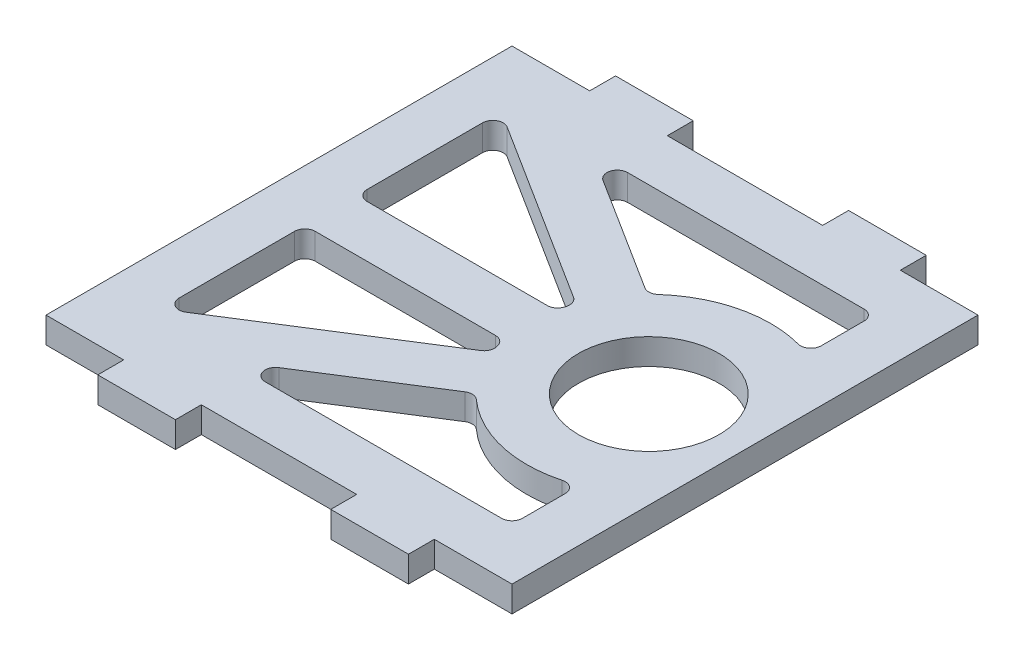
from build123d import *

# Parameters (mm, degrees)
BOSS_EXTRUDE1_DEPTH = 6.35
SKETCH2_R           = 17.250029
CUT_EXTRUDE1_DEPTH  = 167.316670842
CUT_EXTRUDE2_DEPTH  = 167.316670842
FILLET1_R           = 2.54


with BuildPart() as part:
    # Sketch1 → Boss-Extrude1 (new body)
    with BuildSketch(Plane(origin=(0, 0, 0), x_dir=(1, 0, 0), z_dir=(0, 1, 0))):
        Polygon((0, 0), (19.05, 0), (19.05, -6.35), (38.1, -6.35), (38.1, 0), (76.2, 0), (76.2, -6.35), (95.25, -6.35), (95.25, 0), (114.3, 0), (114.3, 114.3), (95.25, 114.3), (95.25, 120.65), (76.2, 120.65), (76.2, 114.3), (38.1, 114.3), (38.1, 120.65), (19.05, 120.65), (19.05, 114.3), (0, 114.3), align=None)
    extrude(amount=-BOSS_EXTRUDE1_DEPTH)

    # Sketch2 → Cut-Extrude1 (cut, through all)
    with BuildSketch(Plane(origin=(0, 0, 0), x_dir=(1, 0, 0), z_dir=(0, 1, 0))):
        with Locations((90.699971, 57.15)):
            Circle(SKETCH2_R)
    extrude(amount=-CUT_EXTRUDE1_DEPTH, mode=Mode.SUBTRACT)

    # Sketch3 → Cut-Extrude2 (cut, through all)
    with BuildSketch(Plane(origin=(0, 0, 0), x_dir=(1, 0, 0), z_dir=(0, 1, 0))):
        with BuildLine():
            ThreePointArc((61.430844995, 63.5), (61.932862595, 65.484129297), (62.569215567, 67.429340245))
            Line((62.569215567, 67.429340245), (12.7, 98.972041843))
            Line((12.7, 98.972041843), (12.7, 63.5))
            Line((12.7, 63.5), (61.430844995, 63.5))
        make_face()
        with BuildLine():
            Line((12.7, 15.327958157), (62.569215567, 46.870659755))
            ThreePointArc((62.569215567, 46.870659755), (61.932862595, 48.815870703), (61.430844995, 50.8))
            Line((61.430844995, 50.8), (12.7, 50.8))
            Line((12.7, 50.8), (12.7, 15.327958157))
        make_face()
        with BuildLine():
            ThreePointArc((101.6, 29.253878318), (84.446639415, 27.860068604), (69.358057015, 36.137457447))
            Line((69.358057015, 36.137457447), (32.303284959, 12.7))
            Line((32.303284959, 12.7), (101.6, 12.7))
            Line((101.6, 12.7), (101.6, 29.253878318))
        make_face()
        with BuildLine():
            Line((32.303284959, 101.6), (69.358057015, 78.162542553))
            ThreePointArc((69.358057015, 78.162542553), (84.446639415, 86.439931396), (101.6, 85.046121682))
            Line((101.6, 85.046121682), (101.6, 101.6))
            Line((101.6, 101.6), (32.303284959, 101.6))
        make_face()
    extrude(amount=-CUT_EXTRUDE2_DEPTH, mode=Mode.SUBTRACT)

    # Fillet1
    fillet1_edges = [part.edges().sort_by_distance(p)[0] for p in [
        (61.430844995, -3.175, -63.5),
        (12.7, -3.175, -63.5),
        (62.569215567, -3.175, -67.429340245),
        (101.6, -3.175, -29.253878318),
        (101.6, -3.175, -12.7),
        (32.303284959, -3.175, -12.7),
        (69.358057015, -3.175, -36.137457447),
        (69.358057015, -3.175, -78.162542553),
        (32.303284959, -3.175, -101.6),
        (101.6, -3.175, -101.6),
        (101.6, -3.175, -85.046121682),
        (62.569215567, -3.175, -46.870659755),
        (12.7, -3.175, -15.327958157),
        (12.7, -3.175, -50.8),
        (61.430844995, -3.175, -50.8),
        (12.7, -3.175, -98.972041843),
    ]]
    fillet(fillet1_edges, radius=FILLET1_R)


solid = part.part
